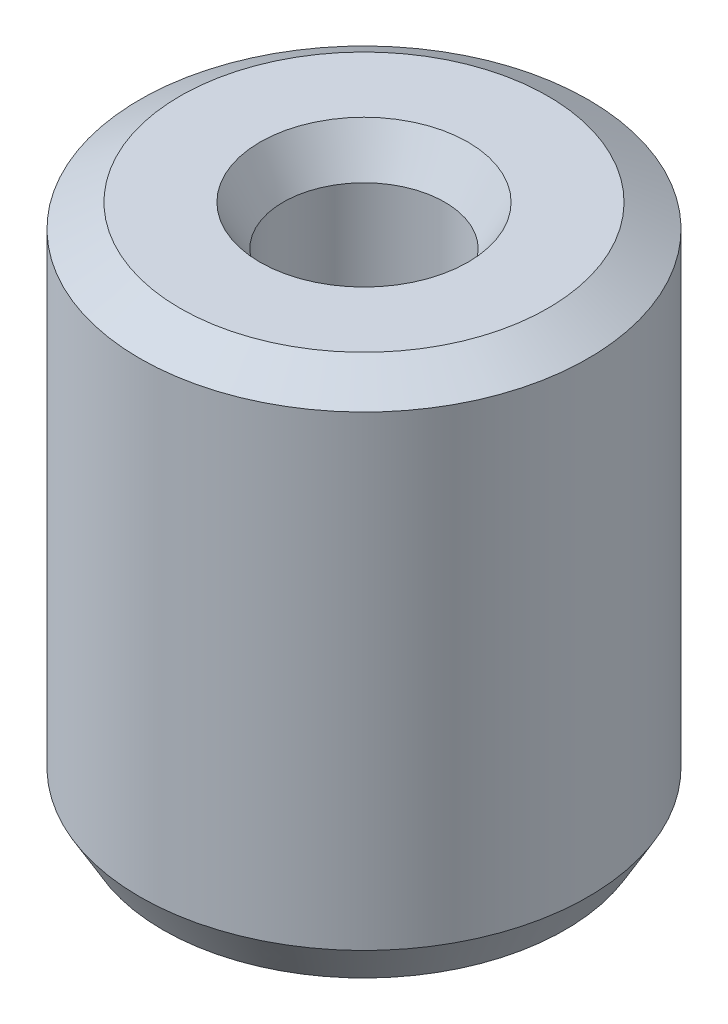
from build123d import *
from OCP.BRepFilletAPI import BRepFilletAPI_MakeChamfer

# Parameters (mm, degrees)
SKETCH1_R           = 12.5
BOSS_EXTRUDE1_DEPTH = 29.541317558
SKETCH2_R           = 4.502745618
CUT_EXTRUDE1_DEPTH  = 35.426580473
CHAMFER1_SIZE       = 1.297333485
CHAMFER1_SIZE2      = 2.24704751


with BuildPart() as part:
    # Sketch1 → Boss-Extrude1 (new body)
    with BuildSketch(Plane(origin=(0, 0, 0), x_dir=(1, 0, 0), z_dir=(0, 1, 0))):
        Circle(SKETCH1_R)
    extrude(amount=BOSS_EXTRUDE1_DEPTH)

    # Sketch2 → Cut-Extrude1 (cut, through all)
    with BuildSketch(Plane(origin=(0, 0, 0), x_dir=(1, 0, 0), z_dir=(0, 1, 0))):
        Circle(SKETCH2_R)
    extrude(amount=CUT_EXTRUDE1_DEPTH, mode=Mode.SUBTRACT)

    # Chamfer1: one chamfer whose edges measure the first distance from different faces: ONE call of the kernel's chamfer builder (chamfer() names one face for all edges)
    chamfer1_edges_1 = [part.edges().sort_by_distance(p)[0] for p in [
        (-4.502745618, 29.541317558, 0),
    ]]
    chamfer1_side_1 = [part.faces().sort_by_distance(p)[0] for p in [
        (-12.146446609, 29.541317558, 0),
    ]]
    chamfer1_edges_2 = [part.edges().sort_by_distance(p)[0] for p in [
        (-4.502745618, 0, 0),
    ]]
    chamfer1_side_2 = [part.faces().sort_by_distance(p)[0] for p in [
        (-4.502745618, 14.770658779, 0),
    ]]
    chamfer1_edges_3 = [part.edges().sort_by_distance(p)[0] for p in [
        (-12.5, 0, 0),
    ]]
    chamfer1_side_3 = [part.faces().sort_by_distance(p)[0] for p in [
        (-12.146446609, 0, 0),
    ]]
    chamfer1_edges_4 = [part.edges().sort_by_distance(p)[0] for p in [
        (-12.5, 29.541317558, 0),
    ]]
    chamfer1_side_4 = [part.faces().sort_by_distance(p)[0] for p in [
        (-12.5, 14.770658779, 0),
    ]]
    chamfer1 = BRepFilletAPI_MakeChamfer(part.part.solid().wrapped)
    for e in chamfer1_edges_1:
        chamfer1.Add(CHAMFER1_SIZE, CHAMFER1_SIZE2, e.wrapped, chamfer1_side_1[0].wrapped)  # the first distance lies on this face
    for e in chamfer1_edges_2:
        chamfer1.Add(CHAMFER1_SIZE, CHAMFER1_SIZE2, e.wrapped, chamfer1_side_2[0].wrapped)  # the first distance lies on this face
    for e in chamfer1_edges_3:
        chamfer1.Add(CHAMFER1_SIZE, CHAMFER1_SIZE2, e.wrapped, chamfer1_side_3[0].wrapped)  # the first distance lies on this face
    for e in chamfer1_edges_4:
        chamfer1.Add(CHAMFER1_SIZE, CHAMFER1_SIZE2, e.wrapped, chamfer1_side_4[0].wrapped)  # the first distance lies on this face
    add(Compound.cast(chamfer1.Shape()), mode=Mode.REPLACE)


solid = part.part
